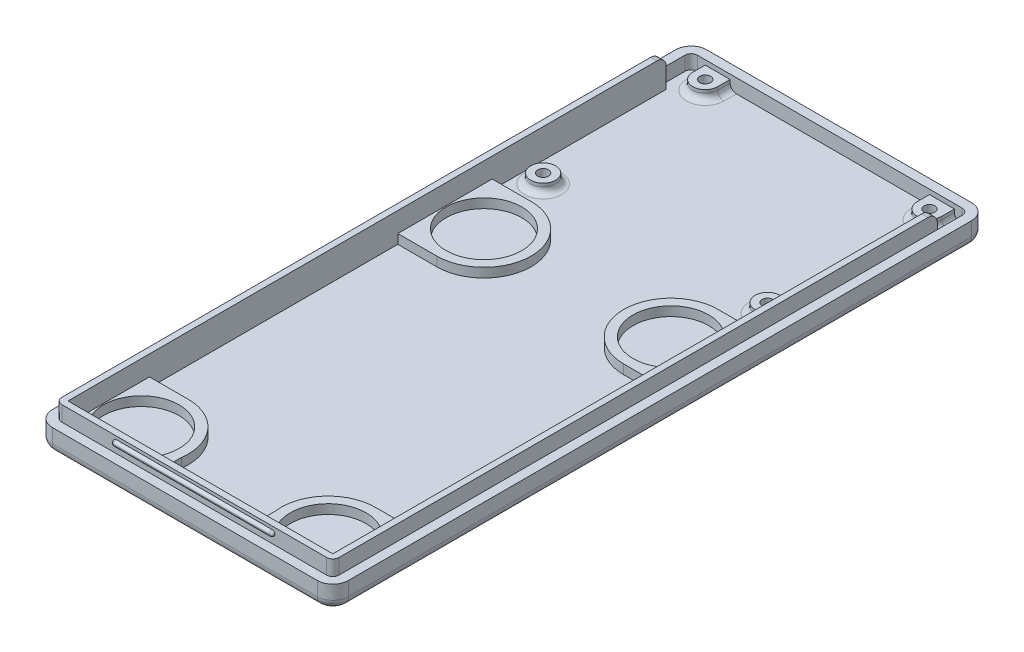
from build123d import *

# Parameters (mm, degrees)
BOSS_EXTRUDE1_DEPTH             = 3
BOSS_EXTRUDE2_DEPTH             = 4.5
SKETCH3_R                       = 4
SKETCH3_R_2                     = 1.4
SKETCH3_R_3                     = 12.15
BOSS_EXTRUDE3_DEPTH             = 3
CUT_EXTRUDE3_REACH              = 117.4
SKETCH6_R                       = 1.75
BOSS_EXTRUDE5_DEPTH             = 4.9
BOSS_EXTRUDE5_DIRECTION_2_REACH = 117.488
FILLET3_R                       = 3
BOSS_EXTRUDE6_DEPTH             = 0.9
FILLET4_R                       = 0.9
CHAMFER4_SIZE                   = 1.5
FILLET6_R                       = 2
FILLET7_R                       = 3


with BuildPart() as part:
    # Sketch1 → Boss-Extrude1 (new body)
    with BuildSketch(Plane(origin=(0, 0, 0), x_dir=(1, 0, 0), z_dir=(0, 1, 0))):
        with BuildLine():
            Line((-42.5, -105), (42.5, -105))
            ThreePointArc((42.5, -105), (46.035533906, -103.535533906), (47.5, -100))
            Line((47.5, -100), (47.5, 100))
            ThreePointArc((47.5, 100), (46.035533906, 103.535533906), (42.5, 105))
            Line((42.5, 105), (-42.5, 105))
            ThreePointArc((-42.5, 105), (-46.035533906, 103.535533906), (-47.5, 100))
            Line((-47.5, 100), (-47.5, -100))
            ThreePointArc((-47.5, -100), (-46.035533906, -103.535533906), (-42.5, -105))
        make_face()
    extrude(amount=BOSS_EXTRUDE1_DEPTH)

    # Sketch2 → Boss-Extrude2 (add)
    with BuildSketch(Plane(origin=(0, 3, 0), x_dir=(1, 0, 0), z_dir=(0, 1, 0))):
        with BuildLine():
            Line((42.5, 105), (-42.5, 105))
            ThreePointArc((-42.5, 105), (-46.035533906, 103.535533906), (-47.5, 100))
            Line((-47.5, 100), (-47.5, -100))
            ThreePointArc((-47.5, -100), (-46.035533906, -103.535533906), (-42.5, -105))
            Line((-42.5, -105), (42.5, -105))
            ThreePointArc((42.5, -105), (46.035533906, -103.535533906), (47.5, -100))
            Line((47.5, -100), (47.5, 100))
            ThreePointArc((47.5, 100), (46.035533906, 103.535533906), (42.5, 105))
        make_face()
        with BuildLine():
            Line((42.5, 102), (-42.5, 102))
            ThreePointArc((-42.5, 102), (-43.914213562, 101.414213562), (-44.5, 100))
            Line((-44.5, 100), (-44.5, -100))
            ThreePointArc((-44.5, -100), (-43.914213562, -101.414213562), (-42.5, -102))
            Line((-42.5, -102), (42.5, -102))
            ThreePointArc((42.5, -102), (43.914213562, -101.414213562), (44.5, -100))
            Line((44.5, -100), (44.5, 100))
            ThreePointArc((44.5, 100), (43.914213562, 101.414213562), (42.5, 102))
        make_face(mode=Mode.SUBTRACT)
    extrude(amount=BOSS_EXTRUDE2_DEPTH)

    # Sketch3 → Boss-Extrude3 (add)
    # profile 1 of 8: a face of its own
    with BuildSketch(Plane(origin=(0, 3, 0), x_dir=(1, 0, 0), z_dir=(0, 1, 0))):
        with Locations(Location((-36, 46, 0), (0, 0, 270))):
            Circle(SKETCH3_R)
        with Locations(Location((-36, 46, 0), (0, 0, 270))):
            Circle(SKETCH3_R_2, mode=Mode.SUBTRACT)
    # profile 2 of 8: a face of its own
    with BuildSketch(Plane(origin=(0, 3, 0), x_dir=(1, 0, 0), z_dir=(0, 1, 0))):
        with Locations(Location((36, 46, 0), (0, 0, 90))):
            Circle(SKETCH3_R)
        with Locations(Location((36, 46, 0), (0, 0, 90))):
            Circle(SKETCH3_R_2, mode=Mode.SUBTRACT)
    # profile 3 of 8: a face of its own
    with BuildSketch(Plane(origin=(0, 3, 0), x_dir=(1, 0, 0), z_dir=(0, 1, 0))):
        with BuildLine():
            Line((-15, -91.126617032), (-15, -102))
            Line((-15, -102), (-44.5, -102))
            Line((-44.5, -102), (-44.5, -73.85))
            Line((-44.5, -73.85), (-30, -73.85))
            ThreePointArc((-30, -73.85), (-18.560140997, -79.06762234), (-15, -91.126617032))
        make_face()
        with Locations(Location((-30, -89, 0), (0, 0, 270))):
            Circle(SKETCH3_R_3, mode=Mode.SUBTRACT)
    # profile 4 of 8: a face of its own
    with BuildSketch(Plane(origin=(0, 3, 0), x_dir=(1, 0, 0), z_dir=(0, 1, 0))):
        with BuildLine():
            Line((-40, 98), (-40, 102))
            Line((-40, 102), (-32, 102))
            Line((-32, 102), (-32, 98))
            ThreePointArc((-32, 98), (-36, 94), (-40, 98))
        make_face()
        with Locations(Location((-36, 98, 0), (0, 0, 270))):
            Circle(SKETCH3_R_2, mode=Mode.SUBTRACT)
    # profile 5 of 8: a face of its own
    with BuildSketch(Plane(origin=(0, 3, 0), x_dir=(1, 0, 0), z_dir=(0, 1, 0))):
        with BuildLine():
            Line((32, 102), (32, 98))
            ThreePointArc((32, 98), (36, 94), (40, 98))
            Line((40, 98), (40, 102))
            Line((40, 102), (32, 102))
        make_face()
        with Locations(Location((36, 98, 0), (0, 0, 90))):
            Circle(SKETCH3_R_2, mode=Mode.SUBTRACT)
    # profile 6 of 8: a face of its own
    with BuildSketch(Plane(origin=(0, 3, 0), x_dir=(1, 0, 0), z_dir=(0, 1, 0))):
        with BuildLine():
            Line((-30, 36.15), (-44.5, 36.15))
            Line((-44.5, 36.15), (-44.5, 5.85))
            Line((-44.5, 5.85), (-30, 5.85))
            ThreePointArc((-30, 5.85), (-14.85, 21), (-30, 36.15))
        make_face()
        with Locations(Location((-30, 21, 0), (0, 0, 270))):
            Circle(SKETCH3_R_3, mode=Mode.SUBTRACT)
    # profile 7 of 8: a face of its own
    with BuildSketch(Plane(origin=(0, 3, 0), x_dir=(1, 0, 0), z_dir=(0, 1, 0))):
        with BuildLine():
            Line((44.5, 5.85), (30, 5.85))
            ThreePointArc((30, 5.85), (14.85, 21), (30, 36.15))
            Line((30, 36.15), (44.5, 36.15))
            Line((44.5, 36.15), (44.5, 5.85))
        make_face()
        with Locations(Location((30, 21, 0), (0, 0, 90))):
            Circle(SKETCH3_R_3, mode=Mode.SUBTRACT)
    # profile 8 of 8: a face of its own
    with BuildSketch(Plane(origin=(0, 3, 0), x_dir=(1, 0, 0), z_dir=(0, 1, 0))):
        with BuildLine():
            Line((15, -102), (44.5, -102))
            Line((44.5, -102), (44.5, -73.85))
            Line((44.5, -73.85), (30, -73.85))
            ThreePointArc((30, -73.85), (18.560140997, -79.06762234), (15, -91.126617032))
            Line((15, -91.126617032), (15, -102))
        make_face()
        with Locations(Location((30, -89, 0), (0, 0, 90))):
            Circle(SKETCH3_R_3, mode=Mode.SUBTRACT)
    extrude(amount=BOSS_EXTRUDE3_DEPTH)

    # Sketch6 → Cut-Extrude3 (cut, up to next)
    with BuildSketch(Plane(origin=(0, 6, 0), x_dir=(1, 0, 0), z_dir=(0, 1, 0)), mode=Mode.PRIVATE) as cut_extrude3_sk1:
        with Locations(Location((-36, 98, 0), (0, 0, 270))):
            Circle(SKETCH6_R)
    cut_extrude3_tool1 = extrude(cut_extrude3_sk1.sketch, amount=-CUT_EXTRUDE3_REACH, mode=Mode.PRIVATE) & part.part
    # Sketch6 → Cut-Extrude3 (cut, up to next)
    with BuildSketch(Plane(origin=(0, 6, 0), x_dir=(1, 0, 0), z_dir=(0, 1, 0)), mode=Mode.PRIVATE) as cut_extrude3_sk2:
        with Locations(Location((36, 98, 0), (0, 0, 270))):
            Circle(SKETCH6_R)
    cut_extrude3_tool2 = extrude(cut_extrude3_sk2.sketch, amount=-CUT_EXTRUDE3_REACH, mode=Mode.PRIVATE) & part.part
    # Sketch6 → Cut-Extrude3 (cut, up to next)
    with BuildSketch(Plane(origin=(0, 6, 0), x_dir=(1, 0, 0), z_dir=(0, 1, 0)), mode=Mode.PRIVATE) as cut_extrude3_sk3:
        with Locations(Location((-36, 46, 0), (0, 0, 270))):
            Circle(SKETCH6_R)
    cut_extrude3_tool3 = extrude(cut_extrude3_sk3.sketch, amount=-CUT_EXTRUDE3_REACH, mode=Mode.PRIVATE) & part.part
    # Sketch6 → Cut-Extrude3 (cut, up to next)
    with BuildSketch(Plane(origin=(0, 6, 0), x_dir=(1, 0, 0), z_dir=(0, 1, 0)), mode=Mode.PRIVATE) as cut_extrude3_sk4:
        with Locations(Location((36, 46, 0), (0, 0, 270))):
            Circle(SKETCH6_R)
    cut_extrude3_tool4 = extrude(cut_extrude3_sk4.sketch, amount=-CUT_EXTRUDE3_REACH, mode=Mode.PRIVATE) & part.part
    add(cut_extrude3_tool1.solids().sort_by_distance((-36, 6, -98))[0], mode=Mode.SUBTRACT)
    add(cut_extrude3_tool2.solids().sort_by_distance((36, 6, -98))[0], mode=Mode.SUBTRACT)
    add(cut_extrude3_tool3.solids().sort_by_distance((-36, 6, -46))[0], mode=Mode.SUBTRACT)
    add(cut_extrude3_tool4.solids().sort_by_distance((36, 6, -46))[0], mode=Mode.SUBTRACT)

    # Sketch5 → Boss-Extrude5 (add)
    with BuildSketch(Plane(origin=(0, 7.5, 0), x_dir=(1, 0, 0), z_dir=(0, 1, 0))):
        with BuildLine():
            Line((-42.5, -102), (42.5, -102))
            ThreePointArc((42.5, -102), (43.914213562, -101.414213562), (44.5, -100))
            Line((44.5, -100), (44.5, 92))
            Line((44.5, 92), (42.5, 92))
            Line((42.5, 92), (42.5, -100))
            Line((42.5, -100), (-42.5, -100))
            Line((-42.5, -100), (-42.5, 92))
            Line((-42.5, 92), (-44.5, 92))
            Line((-44.5, 92), (-44.5, -100))
            ThreePointArc((-44.5, -100), (-43.914213562, -101.414213562), (-42.5, -102))
        make_face()
    extrude(amount=BOSS_EXTRUDE5_DEPTH)

    # Sketch5 → Boss-Extrude5 direction 2 (add, up to next)
    with BuildSketch(Plane(origin=(0, 7.5, 0), x_dir=(1, 0, 0), z_dir=(0, 1, 0)), mode=Mode.PRIVATE) as boss_extrude5_direction_2_sk1:
        with BuildLine():
            Line((-42.5, -102), (42.5, -102))
            ThreePointArc((42.5, -102), (43.914213562, -101.414213562), (44.5, -100))
            Line((44.5, -100), (44.5, 92))
            Line((44.5, 92), (42.5, 92))
            Line((42.5, 92), (42.5, -100))
            Line((42.5, -100), (-42.5, -100))
            Line((-42.5, -100), (-42.5, 92))
            Line((-42.5, 92), (-44.5, 92))
            Line((-44.5, 92), (-44.5, -100))
            ThreePointArc((-44.5, -100), (-43.914213562, -101.414213562), (-42.5, -102))
        make_face()
    boss_extrude5_direction_2_tool1 = extrude(boss_extrude5_direction_2_sk1.sketch, amount=-BOSS_EXTRUDE5_DIRECTION_2_REACH, mode=Mode.PRIVATE) - part.part
    add(boss_extrude5_direction_2_tool1.solids().sort_by_distance((-43.763288, 7.5, 101.263288))[0])

    # Fillet3
    fillet3_edges = [part.edges().sort_by_distance(p)[0] for p in [
        (43.5, 12.4, -92),
        (-43.5, 12.4, -92),
    ]]
    fillet(fillet3_edges, radius=FILLET3_R)

    # Sketch8 → Boss-Extrude6 (add)
    with BuildSketch(Plane.XY.offset(102)):
        with BuildLine():
            Line((-25, 11.4), (25, 11.4))
            ThreePointArc((25, 11.4), (25.9, 10.5), (25, 9.6))
            Line((25, 9.6), (-25, 9.6))
            ThreePointArc((-25, 9.6), (-25.9, 10.5), (-25, 11.4))
        make_face()
    extrude(amount=BOSS_EXTRUDE6_DEPTH)

    # Fillet4
    fillet4_edges = [part.edges().sort_by_distance(p)[0] for p in [
        (25.9, 10.5, 102.9),
        (0, 9.6, 102.9),
        (-25.9, 10.5, 102.9),
        (0, 11.4, 102.9),
    ]]
    fillet(fillet4_edges, radius=FILLET4_R - 0.0001)  # a hair under: the kernel refuses the full size

    # Chamfer4
    chamfer4_edges = [part.edges().sort_by_distance(p)[0] for p in [
        (36, 0, -99.75),
        (-36, 0, -47.75),
        (36, 0, -47.75),
        (-36, 0, -99.75),
    ]]
    chamfer(chamfer4_edges, length=CHAMFER4_SIZE)

    # Fillet6
    fillet6_edges = [part.edges().sort_by_distance(p)[0] for p in [
        (36, 3, -94),
        (40, 3, -100),
        (32, 3, -100),
        (-36, 3, -50),
        (-32, 3, -100),
        (-40, 3, -100),
        (-36, 3, -94),
        (36, 3, -42),
    ]]
    fillet(fillet6_edges, radius=FILLET6_R)

    # Fillet7
    fillet7_edges = [part.edges().sort_by_distance(p)[0] for p in [
        (0, 0, -105),
        (46.035533906, 0, -103.535533906),
        (47.5, 0, 0),
        (46.035533906, 0, 103.535533906),
        (0, 0, 105),
        (-46.035533906, 0, 103.535533906),
        (-47.5, 0, 0),
        (-46.035533906, 0, -103.535533906),
    ]]
    fillet(fillet7_edges, radius=FILLET7_R)


solid = part.part
